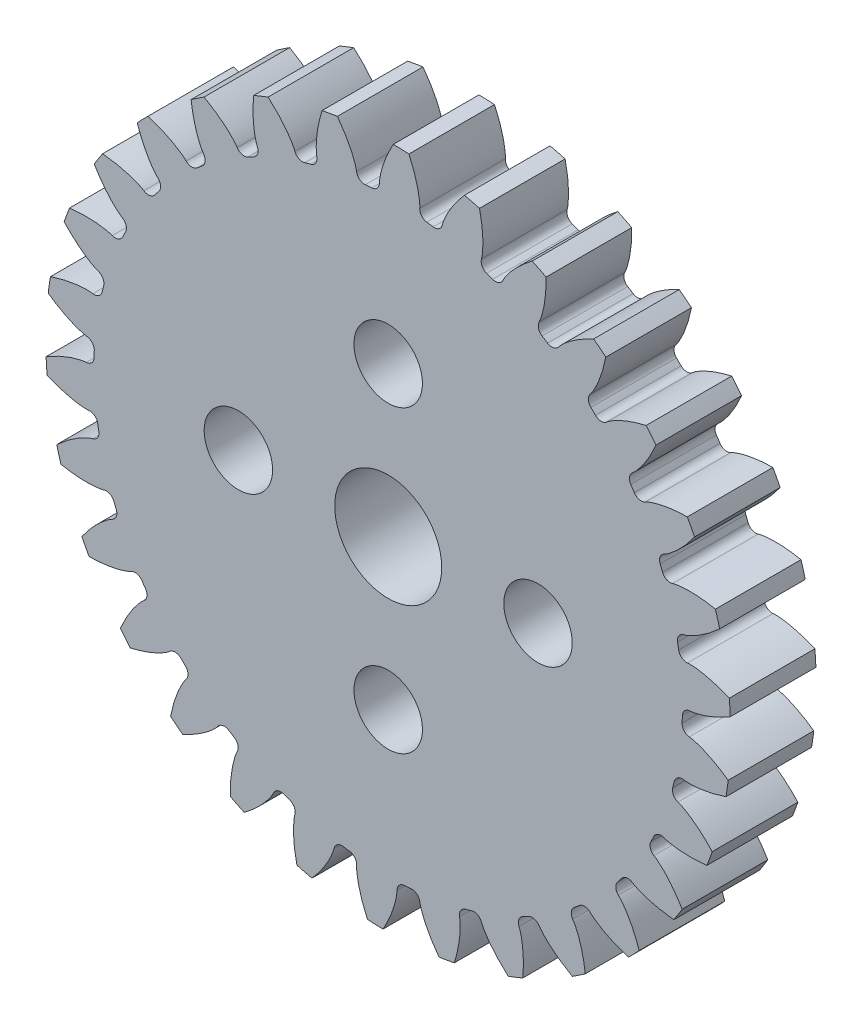
from build123d import *

# Parameters (mm, degrees)
SKETCH_2_R                       = 16
EXTRUDE_1_DEPTH                  = 4
CUT_EXTRUDE_START                = -4
CUT_EXTRUDE_1_DEPTH              = 4
FILLET_1_R                       = 0.38
PATTERN_CIRCULAR_1_COUNT         = 30
FILLET_1_OF_PATTERN_CIRCULAR_1_R = 0.38
SKETCH_4_R                       = 1.6
CUT_EXTRUDE_2_DEPTH              = 4
PATTERN_CIRCULAR_2_COUNT         = 4
SKETCH_6_R                       = 2.5
CUT_EXTRUDE_3_DEPTH              = 10


with BuildPart() as part:
    # 草圖2 → 填料-伸長1 (new body)
    with BuildSketch(Plane.XY):
        Circle(SKETCH_2_R)
    extrude(amount=EXTRUDE_1_DEPTH)

    # 草圖3 → 除料-伸長1 (cut)
    with BuildSketch(Plane.XY.offset(4).offset(CUT_EXTRUDE_START)):
        with BuildLine():
            Line((14.055208689, -1.06353587), (13.710803952, -1.037475297))
            ThreePointArc((13.710803952, -1.037475297), (13.740197494, -0.519107725), (13.75, 0))
            Line((13.75, 0), (14.095389312, 0))
            add(Edge.make_bspline(
                [(14.095389312, 0), (14.101817365, 0.00010682), (14.119839201, 0.000737157), (14.153871457, 0.003234632), (14.209285454, 0.009161503), (14.279670705, 0.019429822), (14.370300919, 0.035811523), (14.476538886, 0.059095353), (14.592633152, 0.088841285), (14.718118481, 0.125665798), (14.842498497, 0.166330204), (14.965740998, 0.210526953), (15.087708034, 0.257816565), (15.234417955, 0.318925846), (15.408849666, 0.397506343), (15.610346774, 0.496995732), (15.787548645, 0.592683475), (15.910207018, 0.66331114), (15.975449986, 0.702023246), (15.984357492, 0.707329882)],
                knots=[0, 0, 0, 0, 0, 0.005376749, 0.015083688, 0.02853182, 0.046610139, 0.064854849, 0.092110525, 0.119476176, 0.146842496, 0.174208854, 0.201574956, 0.228941013, 0.256307345, 0.307035032, 0.361767352, 0.416499661, 0.425166351, 0.425166351, 0.425166351, 0.425166351, 0.425166351], degree=4))
            ThreePointArc((15.984357492, 0.707329882), (15.988593447, -0.604052626), (15.885422152, -1.911377264))
            add(Edge.make_bspline(
                [(14.055208689, -1.06353587), (14.061610359, -1.0641274), (14.079533261, -1.066115737), (14.113280062, -1.07117392), (14.168088897, -1.081265034), (14.237498732, -1.096814843), (14.32663455, -1.119988144), (14.430812843, -1.151221548), (14.544331756, -1.189642317), (14.666680863, -1.23583007), (14.787638078, -1.285763371), (14.907194495, -1.339133117), (15.025245718, -1.395490673), (15.166926561, -1.467495421), (15.334931919, -1.559013267), (15.528347887, -1.67342256), (15.697824719, -1.782207902), (15.814804388, -1.861889145), (15.876940439, -1.905413659), (15.885422152, -1.911377264)],
                knots=[0, 0, 0, 0, 0, 0.005376749, 0.015083688, 0.02853182, 0.046610139, 0.064854849, 0.092110525, 0.119476176, 0.146842496, 0.174208854, 0.201574956, 0.228941013, 0.256307345, 0.307035032, 0.361767352, 0.416499661, 0.425166351, 0.425166351, 0.425166351, 0.425166351, 0.425166351], degree=4))
        make_face()
    cut_extrude_1 = extrude(amount=CUT_EXTRUDE_1_DEPTH, mode=Mode.SUBTRACT)

    # 圓角1
    fillet_1_edges = [part.edges().sort_by_distance(p)[0] for p in [
        (13.710803952, -1.037475297, 2),
        (13.75, 0, 2),
    ]]
    fillet(fillet_1_edges, radius=FILLET_1_R)

    # 環狀複製排列1: 除料-伸長1 ×30 about axis
    pattern_circular_1_axis = Axis((0, 0, 4), (0, 0, -1))
    for i in range(1, PATTERN_CIRCULAR_1_COUNT):
        add(cut_extrude_1.rotate(pattern_circular_1_axis, i * 360 / PATTERN_CIRCULAR_1_COUNT), mode=Mode.SUBTRACT)

    # 圓角1 of 環狀複製排列1
    fillet_1_of_pattern_circular_1_edges = [part.edges().sort_by_distance(p)[0] for p in [
        (13.195486747, -3.865440405, 2),
        (13.44952951, -2.858785749, 2),
        (12.103463451, -6.524467218, 2),
        (12.561250043, -5.592628842, 2),
        (10.482460724, -8.898343507, 2),
        (11.123983673, -8.082047219, 2),
        (8.403324164, -10.883319485, 2),
        (9.200545837, -10.21824135, 2),
        (5.956922013, -12.392642177, 2),
        (6.875, -11.907849302, 2),
        (3.250173786, -13.36034694, 2),
        (4.248983673, -13.077027099, 2),
        (0.401377369, -13.744140432, 2),
        (1.43726637, -13.674676061, 2),
        (-2.464961166, -13.527249035, 2),
        (-1.43726637, -13.674676061, 2),
        (-5.223569069, -12.719151944, 2),
        (-4.248983673, -13.077027099, 2),
        (-7.753881939, -11.35516688, 2),
        (-6.875, -11.907849302, 2),
        (-9.945312961, -9.494906535, 2),
        (-9.200545837, -10.21824135, 2),
        (-11.702086083, -7.219673214, 2),
        (-11.123983673, -8.082047219, 2),
        (-12.94742189, -4.628905528, 2),
        (-12.561250043, -5.592628842, 2),
        (-13.626893233, -1.83583246, 2),
        (-13.44952951, -2.858785749, 2),
        (-13.710803952, 1.037475297, 2),
        (-13.75, 0, 2),
        (-13.195486747, 3.865440405, 2),
        (-13.44952951, 2.858785749, 2),
        (-12.103463451, 6.524467218, 2),
        (-12.561250043, 5.592628842, 2),
        (-10.482460724, 8.898343507, 2),
        (-11.123983673, 8.082047219, 2),
        (-8.403324164, 10.883319485, 2),
        (-9.200545837, 10.21824135, 2),
        (-5.956922013, 12.392642177, 2),
        (-6.875, 11.907849302, 2),
        (-3.250173786, 13.36034694, 2),
        (-4.248983673, 13.077027099, 2),
        (-0.401377369, 13.744140432, 2),
        (-1.43726637, 13.674676061, 2),
        (2.464961166, 13.527249035, 2),
        (1.43726637, 13.674676061, 2),
        (5.223569069, 12.719151944, 2),
        (4.248983673, 13.077027099, 2),
        (7.753881939, 11.35516688, 2),
        (6.875, 11.907849302, 2),
        (9.945312961, 9.494906535, 2),
        (9.200545837, 10.21824135, 2),
        (11.702086083, 7.219673214, 2),
        (11.123983673, 8.082047219, 2),
        (12.94742189, 4.628905528, 2),
        (12.561250043, 5.592628842, 2),
        (13.626893233, 1.83583246, 2),
        (13.44952951, 2.858785749, 2),
    ]]
    fillet(fillet_1_of_pattern_circular_1_edges, radius=FILLET_1_OF_PATTERN_CIRCULAR_1_R)

    # 草圖4 → 除料-伸長2 (cut)
    with BuildSketch(Plane.XY.offset(4)):
        with Locations((7, 0)):
            Circle(SKETCH_4_R)
    cut_extrude_2 = extrude(amount=-CUT_EXTRUDE_2_DEPTH, mode=Mode.SUBTRACT)

    # 環狀複製排列2: 除料-伸長2 ×4 about axis
    pattern_circular_2_axis = Axis((0, 0, 0), (0, 0, 1))
    for i in range(1, PATTERN_CIRCULAR_2_COUNT):
        add(cut_extrude_2.rotate(pattern_circular_2_axis, i * 360 / PATTERN_CIRCULAR_2_COUNT), mode=Mode.SUBTRACT)

    # 草圖6 → 除料-伸長3 (cut)
    with BuildSketch(Plane.XY.offset(4)):
        Circle(SKETCH_6_R)
    extrude(amount=-CUT_EXTRUDE_3_DEPTH, mode=Mode.SUBTRACT)


solid = part.part
